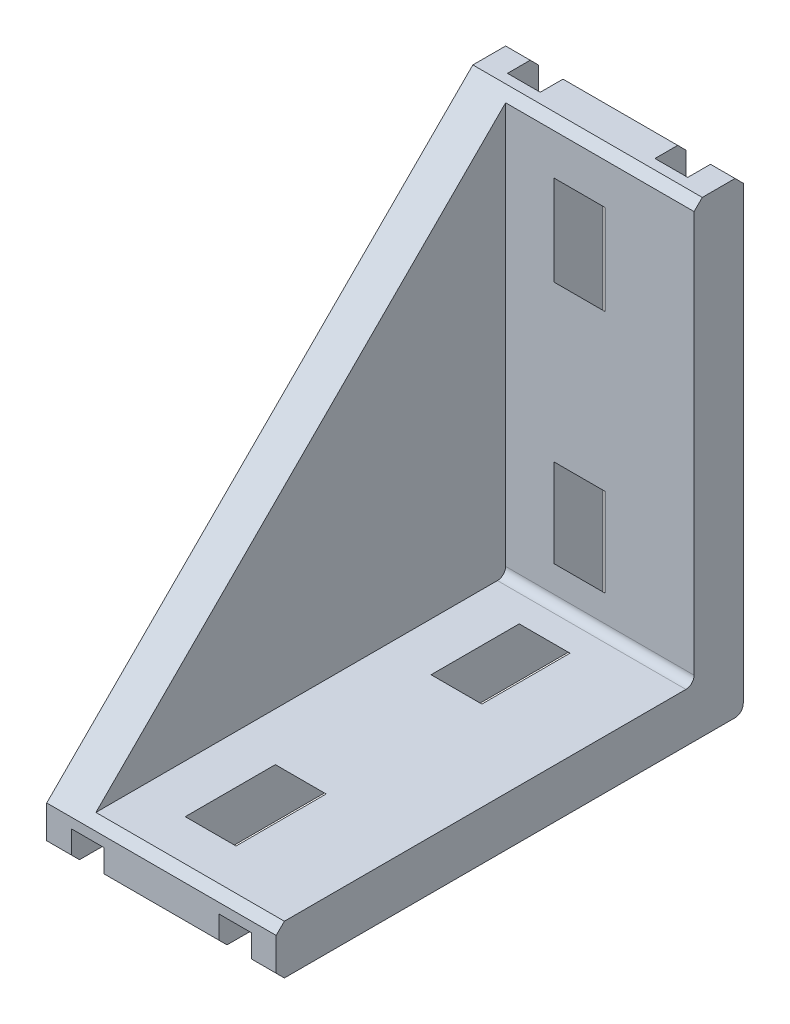
from build123d import *

# Parameters (mm, degrees)
BOSS_EXTRUDE1_DEPTH  = 8
BOSS_EXTRUDE2_DEPTH  = 2
BOSS_EXTRUDE3_DEPTH  = 5
BOSS_EXTRUDE4_DEPTH  = 3
CUT_EXTRUDE1_DEPTH   = 4
CUT_EXTRUDE2_DEPTH   = 4
BOSS_EXTRUDE5_DEPTH  = 2
BOSS_EXTRUDE6_DEPTH  = 1
BOSS_EXTRUDE7_DEPTH  = 2
BOSS_EXTRUDE8_DEPTH  = 2
CUT_EXTRUDE3_DEPTH   = 1
CUT_EXTRUDE4_DEPTH   = 1
CUT_EXTRUDE5_DEPTH   = 1
CUT_EXTRUDE6_DEPTH   = 1
SKETCH15_W           = 8
SKETCH15_H           = 3.1
CUT_EXTRUDE7_DEPTH   = 4
SKETCH16_W           = 12
SKETCH16_H           = 3
CUT_EXTRUDE8_DEPTH   = 3
SKETCH17_W           = 12
SKETCH17_H           = 3
CUT_EXTRUDE9_DEPTH   = 3
SKETCH18_W           = 6.2
SKETCH18_H           = 6
CUT_EXTRUDE10_DEPTH  = 10.757359313
SKETCH19_W           = 6.2
SKETCH19_H           = 6
CUT_EXTRUDE11_DEPTH  = 10.757359313
BOSS_EXTRUDE9_DEPTH  = 3
SKETCH21_W           = 6.2
SKETCH21_H           = 11
CUT_EXTRUDE12_DEPTH  = 78.756028705
SKETCH22_W           = 6.2
SKETCH22_H           = 11
CUT_EXTRUDE13_DEPTH  = 82.816868676
SKETCH23_W           = 8
SKETCH23_H           = 1
BOSS_EXTRUDE10_DEPTH = 2.8
SKETCH24_W           = 8
SKETCH24_H           = 1
BOSS_EXTRUDE11_DEPTH = 2.8
DRAFT1_START         = -3.1
DRAFT1_DEPTH         = 6.2
DRAFT1_START_2       = -4
DRAFT1_2_DEPTH       = 8
DRAFT2_START         = -3.1
DRAFT2_DEPTH         = 6.2
DRAFT2_START_2       = -4
DRAFT2_2_DEPTH       = 8
RIB1_REACH           = 83.817
SKETCH25_WALL_W      = 177.633737352
SKETCH25_WALL_H      = 1
CHAMFER1_SIZE        = 1
FILLET1_R            = 1


# Read off the part's stored shape, not the designer's step: Draft1, Draft2
with BuildPart() as part:
    # Sketch1 → Boss-Extrude1 (new body)
    with BuildSketch(Plane(origin=(4, 0, 0), x_dir=(0, 0, -1), z_dir=(1, 0, 0))):
        Polygon((-51.757359313, 0), (-10.242640687, 0), (-10.242640687, -9.959797975), (9.959797975, 10.242640687), (0, 10.242640687), (0, 51.757359313), (2.121320344, 53.878679656), (-1, 57), (-5, 57), (-6, 56), (-6, 6), (-56, 6), (-57, 5), (-57, 1), (-53.878679656, -2.121320344), align=None)
    extrude(amount=-BOSS_EXTRUDE1_DEPTH)

    # Sketch2 → Boss-Extrude2 (add)
    with BuildSketch(Plane(origin=(4, 0, 0), x_dir=(0, 0, -1), z_dir=(1, 0, 0))):
        Polygon((0, 4.666904756), (-4.666904756, 0), (-51.757359313, 0), (-53.878679656, -2.121320344), (-57, 1), (-57, 5), (-56, 6), (-6, 6), (-6, 56), (-5, 57), (-1, 57), (2.121320344, 53.878679656), (0, 51.757359313), align=None)
    extrude(amount=BOSS_EXTRUDE2_DEPTH)

    # Sketch3 → Boss-Extrude3 (add)
    with BuildSketch(Plane(origin=(6, 0, 0), x_dir=(0, 0, -1), z_dir=(1, 0, 0))):
        Polygon((-51.757359313, 0), (-53.878679656, -2.121320344), (-57, 1), (-57, 5), (-56, 6), (-6, 6), (-6, 56), (-5, 57), (-1, 57), (2.121320344, 53.878679656), (0, 51.757359313), (0, 0), align=None)
    extrude(amount=BOSS_EXTRUDE3_DEPTH)

    # Sketch4 → Boss-Extrude4 (add)
    with BuildSketch(Plane(origin=(11, 0, 0), x_dir=(0, 0, -1), z_dir=(1, 0, 0))):
        Polygon((-5, 57), (0, 57), (0, 0), (-57, 0), (-57, 5), (-56, 6), (-6, 6), (-6, 56), align=None)
    extrude(amount=BOSS_EXTRUDE4_DEPTH)

    # Sketch5 → Cut-Extrude1 (cut)
    with BuildSketch(Plane(origin=(11, 0, 0), x_dir=(0, 0, -1), z_dir=(1, 0, 0))):
        Polygon((-1, 57), (-3.77594834, 57), (0, 52.5), (0, 51.757359313), (2.121320344, 53.878679656), align=None)
    extrude(amount=-CUT_EXTRUDE1_DEPTH, mode=Mode.SUBTRACT)

    # Sketch6 → Cut-Extrude2 (cut)
    with BuildSketch(Plane(origin=(11, 0, 0), x_dir=(0, 0, -1), z_dir=(1, 0, 0))):
        Polygon((-57, 3.77594834), (-57, 1), (-53.878679656, -2.121320344), (-51.757359313, 0), (-52.5, 0), align=None)
    extrude(amount=-CUT_EXTRUDE2_DEPTH, mode=Mode.SUBTRACT)

    # Sketch7 → Boss-Extrude5 (add)
    with BuildSketch(Plane.ZY.offset(4)):
        Polygon((51.757359313, 0), (4.666904756, 0), (0, 4.666904756), (0, 51.757359313), (-2.121320344, 53.878679656), (1, 57), (5, 57), (6, 56), (6, 6), (56, 6), (57, 5), (57, 1), (53.878679656, -2.121320344), align=None)
    extrude(amount=BOSS_EXTRUDE5_DEPTH)

    # Sketch8 → Boss-Extrude6 (add)
    with BuildSketch(Plane.ZY.offset(6)):
        Polygon((0, 51.757359313), (-2.121320344, 53.878679656), (1, 57), (5, 57), (6, 56), (6, 6), (56, 6), (57, 5), (57, 1), (53.878679656, -2.121320344), (51.757359313, 0), (0, 0), align=None)
    extrude(amount=BOSS_EXTRUDE6_DEPTH)

    # Sketch9 → Boss-Extrude7 (add)
    with BuildSketch(Plane.ZY.offset(7)):
        Polygon((5, 57), (6, 56), (6, 6), (56, 6), (57, 5), (57, 3.77594834), (52.5, 0), (0, 0), (0, 52.5), (3.77594834, 57), align=None)
    extrude(amount=BOSS_EXTRUDE7_DEPTH)

    # Sketch10 → Boss-Extrude8 (add)
    with BuildSketch(Plane.ZY.offset(9)):
        Polygon((0, 0), (0, 52.5), (3.77594834, 57), (5, 57), (57, 5), (57, 3.77594834), (52.5, 0), align=None)
    extrude(amount=BOSS_EXTRUDE8_DEPTH)

    # Sketch11 → Cut-Extrude3 (cut)
    with BuildSketch(Plane.ZY.offset(7)):
        Polygon((53.878679656, -2.121320344), (56, 0), (51.757359313, 0), align=None)
    extrude(amount=-CUT_EXTRUDE3_DEPTH, mode=Mode.SUBTRACT)

    # Sketch12 → Cut-Extrude4 (cut)
    with BuildSketch(Plane(origin=(7, 0, 0), x_dir=(0, 0, -1), z_dir=(1, 0, 0))):
        Polygon((-51.757359313, 0), (-56, 0), (-53.878679656, -2.121320344), align=None)
    extrude(amount=-CUT_EXTRUDE4_DEPTH, mode=Mode.SUBTRACT)

    # Sketch13 → Cut-Extrude5 (cut)
    with BuildSketch(Plane(origin=(7, 0, 0), x_dir=(0, 0, -1), z_dir=(1, 0, 0))):
        Polygon((0, 56), (0, 51.757359313), (2.121320344, 53.878679656), align=None)
    extrude(amount=-CUT_EXTRUDE5_DEPTH, mode=Mode.SUBTRACT)

    # Sketch14 → Cut-Extrude6 (cut)
    with BuildSketch(Plane.ZY.offset(7)):
        Polygon((-2.121320344, 53.878679656), (0, 51.757359313), (0, 56), align=None)
    extrude(amount=-CUT_EXTRUDE6_DEPTH, mode=Mode.SUBTRACT)

    # Sketch15 → Cut-Extrude7 (cut)
    with BuildSketch(Plane(origin=(0, 1.414213562, -1.414213562), x_dir=(-1, 0, 0), z_dir=(0, 0.7071067811865474, -0.7071067811865477))):
        with Locations((0, 1.75)):
            Rectangle(SKETCH15_W, SKETCH15_H)
    extrude(amount=-CUT_EXTRUDE7_DEPTH, mode=Mode.SUBTRACT)

    # Sketch16 → Cut-Extrude8 (cut)
    with BuildSketch(Plane(origin=(0, 25.878679656, 25.878679656), x_dir=(-1, 0, 0), z_dir=(0, -0.707106781186546, -0.7071067811865491))):
        with Locations((0, 38.097979746)):
            Rectangle(SKETCH16_W, SKETCH16_H)
    extrude(amount=-CUT_EXTRUDE8_DEPTH, mode=Mode.SUBTRACT)

    # Sketch17 → Cut-Extrude9 (cut)
    with BuildSketch(Plane(origin=(0, 25.878679656, 25.878679656), x_dir=(-1, 0, 0), z_dir=(0, -0.7071067811865469, -0.7071067811865481))):
        with Locations((0, -38.097979746)):
            Rectangle(SKETCH17_W, SKETCH17_H)
    extrude(amount=-CUT_EXTRUDE9_DEPTH, mode=Mode.SUBTRACT)

    # Sketch18 → Cut-Extrude10 (cut)
    with BuildSketch(Plane.XZ.offset(-10.242640687)):
        with Locations((0, 3)):
            Rectangle(SKETCH18_W, SKETCH18_H)
    extrude(amount=-CUT_EXTRUDE10_DEPTH, mode=Mode.SUBTRACT)

    # Sketch19 → Cut-Extrude11 (cut)
    with BuildSketch(Plane(origin=(0, 0, 10.242640687), x_dir=(-1, 0, 0), z_dir=(0, 0, -1))):
        with Locations((0, 3)):
            Rectangle(SKETCH19_W, SKETCH19_H)
    extrude(amount=-CUT_EXTRUDE11_DEPTH, mode=Mode.SUBTRACT)

    # Sketch20 → Boss-Extrude9 (add)
    with BuildSketch(Plane.ZY.offset(11)):
        Polygon((57, 0), (0, 0), (0, 57), (5, 57), (57, 5), align=None)
    extrude(amount=BOSS_EXTRUDE9_DEPTH)

    # Sketch21 → Cut-Extrude12 (cut, through all)
    with BuildSketch(Plane.XY.offset(6)):
        with Locations((0, 45.5)):
            Rectangle(SKETCH21_W, SKETCH21_H)
    extrude(amount=-CUT_EXTRUDE12_DEPTH, mode=Mode.SUBTRACT)

    # Sketch22 → Cut-Extrude13 (cut, through all)
    with BuildSketch(Plane.XZ):
        with Locations((0, 45.5)):
            Rectangle(SKETCH22_W, SKETCH22_H)
    extrude(amount=-CUT_EXTRUDE13_DEPTH, mode=Mode.SUBTRACT)

    # Sketch23 → Boss-Extrude10 (add)
    with BuildSketch(Plane(origin=(0, 28, 28), x_dir=(-1, 0, 0), z_dir=(0, -0.7071067811865448, -0.7071067811865503))):
        with Locations((0, 39.097979746)):
            Rectangle(SKETCH23_W, SKETCH23_H)
    extrude(amount=BOSS_EXTRUDE10_DEPTH)

    # Sketch24 → Boss-Extrude11 (add)
    with BuildSketch(Plane(origin=(0, 28, 28), x_dir=(-1, 0, 0), z_dir=(0, -0.7071067811865471, -0.7071067811865479))):
        with Locations((0, -39.097979746)):
            Rectangle(SKETCH24_W, SKETCH24_H)
    extrude(amount=BOSS_EXTRUDE11_DEPTH)

    # Draft1 outline → Draft1 (cut)
    with BuildSketch(Plane.YZ.offset(DRAFT1_START)):
        Polygon((0, 40), (0, 34), (6, 40), align=None)
        Polygon((6, 10.242640687), (-9.959797975, 10.242640687), (-1.979898987, 2.2627417), align=None)
    extrude(amount=DRAFT1_DEPTH, mode=Mode.SUBTRACT)

    # Draft1 2 outline → Draft1 2 (cut)
    with BuildSketch(Plane.YZ.offset(DRAFT1_START_2)):
        Polygon((-1.979898987, 2.2627417), (0, 4.242640687), (0, 10.242640687), (-9.959797975, 10.242640687), align=None)
    extrude(amount=DRAFT1_2_DEPTH, mode=Mode.SUBTRACT)

    # Draft2 outline → Draft2 (cut)
    with BuildSketch(Plane.YZ.offset(DRAFT2_START)):
        Polygon((40, 6), (34, 0), (40, 0), align=None)
        Polygon((2.2627417, -1.979898987), (10.242640687, -9.959797975), (10.242640687, 6), align=None)
    extrude(amount=DRAFT2_DEPTH, mode=Mode.SUBTRACT)

    # Draft2 2 outline → Draft2 2 (cut)
    with BuildSketch(Plane.YZ.offset(DRAFT2_START_2)):
        Polygon((4.242640687, 0), (2.2627417, -1.979898987), (10.242640687, -9.959797975), (10.242640687, 0), align=None)
    extrude(amount=DRAFT2_2_DEPTH, mode=Mode.SUBTRACT)

    # Sketch25 wall → Rib1 (add, up to next)
    with BuildSketch(Plane(origin=(0, 1.626345597, 1.626345597), x_dir=(-1, 0, 0), z_dir=(0, 0.707106781187, 0.707106781187)), mode=Mode.PRIVATE) as rib1_sk1:
        Rectangle(SKETCH25_WALL_W, SKETCH25_WALL_H)
    rib1_tool1 = extrude(rib1_sk1.sketch, amount=RIB1_REACH, mode=Mode.PRIVATE) - part.part
    add(rib1_tool1.solids().sort_by_distance((0, 1.626345597, 1.626345597))[0])

    # Chamfer1
    chamfer1_edges = [part.edges().sort_by_distance(p)[0] for p in [
        (12.5, 57, 0),
        (-12.5, 57, 0),
        (-12.5, 0, 57),
        (12.5, 0, 57),
    ]]
    chamfer(chamfer1_edges, length=CHAMFER1_SIZE)

    # Fillet1
    fillet1_edges = [part.edges().sort_by_distance(p)[0] for p in [
        (2.5, 6, 6),
        (-10, 0, 0),
        (10, 0, 0),
    ]]
    fillet(fillet1_edges, radius=FILLET1_R)


solid = part.part
